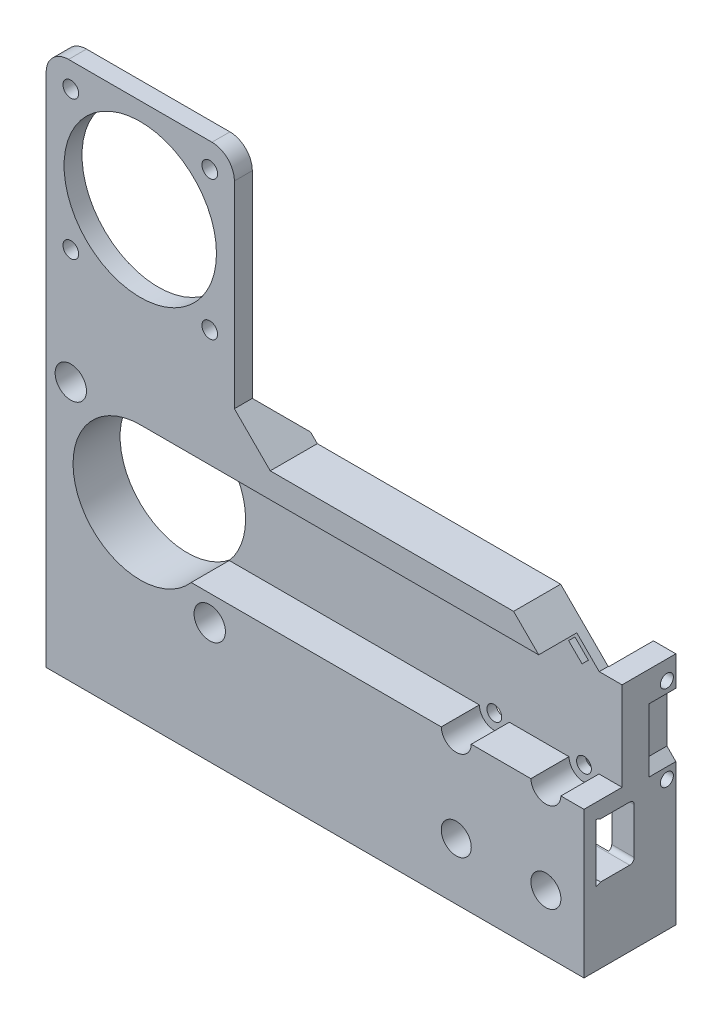
from build123d import *

# Parameters (mm, degrees)
SKETCH1_W               = 120
SKETCH1_H               = 45.4
BOSS_EXTRUDE1_DEPTH     = 10.5
SKETCH2_W               = 5
SKETCH2_H               = 45.4
BOSS_EXTRUDE2_DEPTH     = 10
CUT_EXTRUDE1_DEPTH      = 7.8
CUT_EXTRUDE1_DEPTH_BACK = 129.729988736
SKETCH3_W               = 78
SKETCH3_H               = 12.2
BOSS_EXTRUDE3_START     = -10.5
SKETCH4_W               = 42
SKETCH4_H               = 41
BOSS_EXTRUDE3_DEPTH     = 10.5
SKETCH5_R               = 15
SKETCH5_R_2             = 1.7
CUT_EXTRUDE2_DEPTH      = 138.073885186
SKETCH7_W               = 30
SKETCH7_H               = 8
BOSS_EXTRUDE4_DEPTH     = 44.2
SKETCH8_R               = 1.65
CUT_EXTRUDE4_DEPTH      = 147.154336234
FILLET1_SIZE            = 15
FILLET1_SIZE_2          = 6
SKETCH9_R               = 2.6
SKETCH9_R_2             = 12
CUT_EXTRUDE5_DEPTH      = 10
SKETCH10_R              = 3.35
CUT_EXTRUDE6_DEPTH      = 8.5
SKETCH12_R              = 3.5
CUT_EXTRUDE7_DEPTH      = 5.5
SKETCH6_W               = 105.644224039
SKETCH6_H               = 30.4
CUT_EXTRUDE3_DEPTH      = 8.5
CHAMFER1_SIZE           = 5
CHAMFER1_SIZE2          = 13.737387097
SKETCH13_W              = 14
SKETCH13_H              = 32.158687744
CUT_EXTRUDE8_DEPTH      = 10
CUT_EXTRUDE16_DEPTH     = 78
SKETCH24_W              = 5
SKETCH24_H              = 9.3
BOSS_EXTRUDE8_DEPTH     = 12.2
FILLET4_START           = 115
FILLET4_DEPTH           = 5
FILLET4_START_2         = 41
FILLET4_2_DEPTH         = 79
SKETCH15_R              = 2.75
BOSS_EXTRUDE9_DEPTH     = 2
CHAMFER4_SIZE           = 2
CHAMFER5_DEPTH          = 8
SKETCH25_W              = 5
SKETCH25_H              = 12
BOSS_EXTRUDE10_DEPTH    = 7
SKETCH26_R              = 1.45
CUT_EXTRUDE17_DEPTH     = 7
SKETCH27_W              = 2
SKETCH27_H              = 14.15
CUT_EXTRUDE18_DEPTH     = 6
CHAMFER6_SIZE           = 2
SKETCH28_W              = 2
SKETCH28_H              = 17.6
BOSS_EXTRUDE11_DEPTH    = 73
SKETCH30_W              = 94
SKETCH30_H              = 5.6
BOSS_EXTRUDE12_DEPTH    = 8.5
CHAMFER8_SIZE           = 10.7
SKETCH31_W              = 42
SKETCH31_H              = 4
BOSS_EXTRUDE13_DEPTH    = 57
SKETCH32_R              = 17.001029839
CUT_EXTRUDE20_DEPTH     = 10
SKETCH33_R              = 1.75
CUT_EXTRUDE21_DEPTH     = 10
CHAMFER10_SIZE          = 8
FILLET6_R               = 5
CHAMFER11_SIZE          = 8
CUT_EXTRUDE22_DEPTH     = 10


with BuildPart() as part:
    # Sketch1 → Boss-Extrude1 (new body)
    with BuildSketch(Plane.XY):
        with Locations((60, 22.7)):
            Rectangle(SKETCH1_W, SKETCH1_H)
    extrude(amount=BOSS_EXTRUDE1_DEPTH)

    # Sketch2 → Boss-Extrude2 (add)
    with BuildSketch(Plane(origin=(0, 0, 0), x_dir=(-1, 0, 0), z_dir=(0, 0, -1))):
        with Locations((-117.5, 22.7)):
            Rectangle(SKETCH2_W, SKETCH2_H)
    extrude(amount=BOSS_EXTRUDE2_DEPTH)

    # Sketch3 → Cut-Extrude1 (cut, two sides: drawn at the far end of the back side and taken through both)
    with BuildSketch(Plane.XY.offset(-CUT_EXTRUDE1_DEPTH_BACK)):
        with Locations((81, 22.8)):
            Rectangle(SKETCH3_W, SKETCH3_H)
    extrude(amount=CUT_EXTRUDE1_DEPTH + CUT_EXTRUDE1_DEPTH_BACK, mode=Mode.SUBTRACT)

    # Sketch4 → Boss-Extrude3 (add)
    with BuildSketch(Plane(origin=(0, 0, 0), x_dir=(-1, 0, 0), z_dir=(0, 0, -1)).offset(BOSS_EXTRUDE3_START)):
        with Locations((-21, 42.5)):
            Rectangle(SKETCH4_W, SKETCH4_H)
    extrude(amount=BOSS_EXTRUDE3_DEPTH)

    # Sketch5 → Cut-Extrude2 (cut, through all)
    with BuildSketch(Plane.XY.offset(10.5)):
        with Locations((21, 42.4)):
            Circle(SKETCH5_R)
        with Locations((5.5, 57.9)):
            Circle(SKETCH5_R_2)
        with Locations((36.5, 26.9)):
            Circle(SKETCH5_R_2)
    extrude(amount=-CUT_EXTRUDE2_DEPTH, mode=Mode.SUBTRACT)

    # Sketch7 → Boss-Extrude4 (add)
    with BuildSketch(Plane(origin=(0, 0, 0), x_dir=(-1, 0, 0), z_dir=(0, 0, -1))):
        with Locations((-65.5, 4)):
            Rectangle(SKETCH7_W, SKETCH7_H)
    extrude(amount=BOSS_EXTRUDE4_DEPTH)

    # Sketch8 → Cut-Extrude4 (cut, through all)
    with BuildSketch(Plane.XY.offset(10.5)):
        with Locations((91.5, 32.7)):
            Circle(SKETCH8_R)
        with Locations((111.5, 32.7)):
            Circle(SKETCH8_R)
        with Locations((111.5, 12.7)):
            Circle(SKETCH8_R)
        with Locations((91.5, 12.7)):
            Circle(SKETCH8_R)
    extrude(amount=-CUT_EXTRUDE4_DEPTH, mode=Mode.SUBTRACT)

    # Fillet1
    # a fillet whose section is not a circle: 15, 6 mm, written as the material it takes off along each edge
    with BuildSketch(Plane(origin=(50.5, -37.5, -44.2), x_dir=(1, 0, 0), z_dir=(0, 1, 0))) as fillet1_piece_1:
        with BuildLine():
            Bezier((FILLET1_SIZE, 0), (0, 0), (0, -FILLET1_SIZE_2), weights=[1, 0.428571429, 1])
            Line((0, -FILLET1_SIZE_2), (0, 0))
            Line((0, 0), (FILLET1_SIZE, 0))
        make_face()
    extrude(amount=83, mode=Mode.SUBTRACT)
    with BuildSketch(Plane(origin=(80.5, 45.5, -44.2), x_dir=(0, 0, 1), z_dir=(0, -1, 0))) as fillet1_piece_2:
        with BuildLine():
            Bezier((FILLET1_SIZE_2, 0), (0, 0), (0, FILLET1_SIZE), weights=[1, 0.428571429, 1])
            Line((0, FILLET1_SIZE), (0, 0))
            Line((0, 0), (FILLET1_SIZE_2, 0))
        make_face()
    extrude(amount=83, mode=Mode.SUBTRACT)

    # Sketch9 → Cut-Extrude5 (cut)
    with BuildSketch(Plane(origin=(0, 8, 0), x_dir=(1, 0, 0), z_dir=(0, 1, 0))):
        with Locations(Location((54.155391929, 34.515048602, 0), (0, 0, 180))):
            Circle(SKETCH9_R)
        with Locations(Location((65.469100428, 39.201340103, 0), (0, 0, 180))):
            Circle(SKETCH9_R)
        with Locations(Location((76.782808927, 34.515048602, 0), (0, 0, 180))):
            Circle(SKETCH9_R)
        with Locations(Location((65.469100428, 23.201340103, 0), (0, 0, 180))):
            Circle(SKETCH9_R_2)
        with Locations(Location((54.155391929, 11.887631605, 0), (0, 0, 180))):
            Circle(SKETCH9_R)
        with Locations(Location((76.782808927, 11.887631605, 0), (0, 0, 180))):
            Circle(SKETCH9_R)
    extrude(amount=-CUT_EXTRUDE5_DEPTH, mode=Mode.SUBTRACT)

    # Sketch10 → Cut-Extrude6 (cut)
    with BuildSketch(Plane.XY.offset(10.5)):
        with Locations((91.5, 32.7)):
            Circle(SKETCH10_R)
        with Locations((111.5, 32.7)):
            Circle(SKETCH10_R)
        with Locations((111.5, 12.7)):
            Circle(SKETCH10_R)
        with Locations((91.5, 12.7)):
            Circle(SKETCH10_R)
    extrude(amount=-CUT_EXTRUDE6_DEPTH, mode=Mode.SUBTRACT)

    # Sketch12 → Cut-Extrude7 (cut)
    with BuildSketch(Plane.XY.offset(10.5)):
        with Locations((5.5, 57.9)):
            Circle(SKETCH12_R)
        with Locations((36.5, 26.9)):
            Circle(SKETCH12_R)
    extrude(amount=-CUT_EXTRUDE7_DEPTH, mode=Mode.SUBTRACT)

    # Sketch6 → Cut-Extrude3 (cut)
    with BuildSketch(Plane.XY.offset(10.5)):
        with Locations((73.822112019, 47.8)):
            Rectangle(SKETCH6_W, SKETCH6_H)
    extrude(amount=-CUT_EXTRUDE3_DEPTH, mode=Mode.SUBTRACT)

    # Chamfer1
    chamfer1_edges = [part.edges().sort_by_distance(p)[0] for p in [
        (80.5, 4, 0),
    ]]
    chamfer1_side = [part.faces().sort_by_distance(p)[0] for p in [
        (40.688741063, 22.8, 0),
    ]]
    chamfer(chamfer1_edges, length=CHAMFER1_SIZE, length2=CHAMFER1_SIZE2, reference=chamfer1_side[0])

    # Sketch13 → Cut-Extrude8 (cut)
    with BuildSketch(Plane(origin=(0, 8, 0), x_dir=(1, 0, 0), z_dir=(0, 1, 0))):
        with Locations((65.469100428, 39.201340103)):
            Rectangle(SKETCH13_W, SKETCH13_H)
    extrude(amount=-CUT_EXTRUDE8_DEPTH, mode=Mode.SUBTRACT)

    # Sketch23 → Cut-Extrude16 (cut)
    with BuildSketch(Plane(origin=(120, 0, 0), x_dir=(0, 0, -1), z_dir=(1, 0, 0))):
        Polygon((-6.8, 28.9), (-7.8, 28.9), (-7.8, 29.3), align=None)
        Polygon((-7.8, 16.7), (-7.8, 16.3), (-6.8, 16.7), align=None)
    extrude(amount=-CUT_EXTRUDE16_DEPTH, mode=Mode.SUBTRACT)

    # Sketch24 → Boss-Extrude8 (add)
    with BuildSketch(Plane(origin=(0, 16.7, 0), x_dir=(1, 0, 0), z_dir=(0, 1, 0))):
        with Locations((117.5, 5.35)):
            Rectangle(SKETCH24_W, SKETCH24_H)
    extrude(amount=BOSS_EXTRUDE8_DEPTH)

    # Fillet4: read off the stored shape, not the designer's step
    # Fillet4 outline → Fillet4 (add)
    with BuildSketch(Plane.YZ.offset(FILLET4_START)):
        with BuildLine():
            ThreePointArc((28.9, 0.3), (28.607106781, -0.407106781), (27.9, -0.7))
            Line((27.9, -0.7), (28.9, -0.7))
            Line((28.9, -0.7), (28.9, 0.3))
        make_face()
        with BuildLine():
            Line((16.7, 0.3), (16.7, -0.7))
            Line((16.7, -0.7), (17.7, -0.7))
            ThreePointArc((17.7, -0.7), (16.992893219, -0.407106781), (16.7, 0.3))
        make_face()
    extrude(amount=FILLET4_DEPTH)

    # Fillet4 2 outline → Fillet4 2 (add)
    with BuildSketch(Plane.YZ.offset(FILLET4_START_2)):
        with BuildLine():
            Line((28.9, 0), (28.9, 0.3))
            ThreePointArc((28.9, 0.3), (28.888417726, 0.148242301), (28.853939201, 0))
            Line((28.853939201, 0), (28.9, 0))
        make_face()
        with BuildLine():
            Line((16.7, 0), (16.746060799, 0))
            ThreePointArc((16.746060799, 0), (16.711582274, 0.148242301), (16.7, 0.3))
            Line((16.7, 0.3), (16.7, 0))
        make_face()
    extrude(amount=FILLET4_2_DEPTH)

    # Sketch15 → Boss-Extrude9 (add)
    with BuildSketch(Plane(origin=(0, 8, 0), x_dir=(1, 0, 0), z_dir=(0, 1, 0))):
        with Locations((65.469100428, 7.201340104)):
            Circle(SKETCH15_R)
    extrude(amount=BOSS_EXTRUDE9_DEPTH)

    # Chamfer4
    chamfer4_edges = [part.edges().sort_by_distance(p)[0] for p in [
        (62.719100428, 10, -7.201340104),
    ]]
    chamfer(chamfer4_edges, length=CHAMFER4_SIZE - 0.0001)  # a hair under: the kernel refuses the full size

    # Chamfer5: read off the stored shape, not the designer's step
    # Chamfer5 outline → Chamfer5 (add)
    with BuildSketch(Plane(origin=(0, 0, 0), x_dir=(1, 0, 0), z_dir=(0, 1, 0))):
        with BuildLine():
            add(Edge.make_bspline(
                [(50.775443099, 38.961367817), (50.5, 38.551094872), (50.5, 38.2)],
                knots=[0.873344875, 0.873344875, 0.873344875, 1, 1, 1], degree=2, weights=[0.873584452, 0.927625643, 1]))
            Line((50.775443099, 38.961367817), (0, 0))
            Line((0, 0), (50.5, 0))
            Line((50.5, 0), (50.5, 38.2))
        make_face()
    extrude(amount=CHAMFER5_DEPTH)

    # Sketch25 → Boss-Extrude10 (add)
    with BuildSketch(Plane(origin=(0, 45.4, 0), x_dir=(1, 0, 0), z_dir=(0, 1, 0))):
        with Locations((117.5, 4)):
            Rectangle(SKETCH25_W, SKETCH25_H)
    extrude(amount=BOSS_EXTRUDE10_DEPTH)

    # Sketch26 → Cut-Extrude17 (cut)
    with BuildSketch(Plane(origin=(120, 0, 0), x_dir=(0, 0, -1), z_dir=(1, 0, 0))):
        with Locations(Location((8, 48.175, 0), (0, 0, 90))):
            Circle(SKETCH26_R)
        with Locations(Location((8, 29.125, 0), (0, 0, 90))):
            Circle(SKETCH26_R)
    extrude(amount=-CUT_EXTRUDE17_DEPTH, mode=Mode.SUBTRACT)

    # Sketch27 → Cut-Extrude18 (cut)
    with BuildSketch(Plane(origin=(0, 0, -10), x_dir=(-1, 0, 0), z_dir=(0, 0, -1))):
        with Locations((-119, 38.65)):
            Rectangle(SKETCH27_W, SKETCH27_H)
    extrude(amount=-CUT_EXTRUDE18_DEPTH, mode=Mode.SUBTRACT)

    # Chamfer6
    chamfer6_edges = [part.edges().sort_by_distance(p)[0] for p in [
        (118, 45.725, -7),
        (118, 31.575, -7),
    ]]
    chamfer(chamfer6_edges, length=CHAMFER6_SIZE - 0.0001)  # a hair under: the kernel refuses the full size

    # Sketch28 → Boss-Extrude11 (add)
    with BuildSketch(Plane(origin=(42, 0, 0), x_dir=(0, 0, -1), z_dir=(1, 0, 0))):
        with Locations((-1, 54.2)):
            Rectangle(SKETCH28_W, SKETCH28_H)
    extrude(amount=BOSS_EXTRUDE11_DEPTH)

    # Sketch30 → Boss-Extrude12 (add)
    with BuildSketch(Plane.XY.offset(2)):
        with Locations((68, 60.2)):
            Rectangle(SKETCH30_W, SKETCH30_H)
    extrude(amount=BOSS_EXTRUDE12_DEPTH)

    # Chamfer8
    # the kernel refuses this chamfer: 10.7 mm, written as the material it takes off along each edge
    with BuildSketch(Plane(origin=(115, 63, -27.517007971), x_dir=(-1, 0, 0), z_dir=(0, 0, 1))) as chamfer8_piece_1_section:
        Polygon((CHAMFER8_SIZE, 0), (0, CHAMFER8_SIZE), (0, 0), align=None)
    chamfer8_piece_1 = extrude(amount=65.534015942, mode=Mode.PRIVATE)
    chamfer8_piece_1 = split(chamfer8_piece_1, bisect_by=Plane(origin=(115, 52.4, -27.517007971), z_dir=(0, 1, 0)), keep=Keep.TOP, mode=Mode.PRIVATE)
    add(chamfer8_piece_1, mode=Mode.SUBTRACT)

    # Sketch31 → Boss-Extrude13 (add)
    with BuildSketch(Plane(origin=(0, 63, 0), x_dir=(1, 0, 0), z_dir=(0, 1, 0))):
        with Locations((21, -8.5)):
            Rectangle(SKETCH31_W, SKETCH31_H)
    extrude(amount=BOSS_EXTRUDE13_DEPTH)

    # Sketch32 → Cut-Extrude20 (cut)
    with BuildSketch(Plane.XY.offset(10.5)):
        with Locations((21.000438713, 99)):
            Circle(SKETCH32_R)
    extrude(amount=-CUT_EXTRUDE20_DEPTH, mode=Mode.SUBTRACT)

    # Sketch33 → Cut-Extrude21 (cut)
    with BuildSketch(Plane(origin=(0, 0, 6.5), x_dir=(-1, 0, 0), z_dir=(0, 0, -1))):
        with Locations((-36.500438713, 114.5)):
            Circle(SKETCH33_R)
        with Locations((-5.500438713, 114.5)):
            Circle(SKETCH33_R)
        with Locations((-5.500438713, 83.5)):
            Circle(SKETCH33_R)
        with Locations((-36.500438713, 83.5)):
            Circle(SKETCH33_R)
    extrude(amount=-CUT_EXTRUDE21_DEPTH, mode=Mode.SUBTRACT)

    # Chamfer10
    chamfer10_edges = [part.edges().sort_by_distance(p)[0] for p in [
        (42, 63, 8.5),
    ]]
    chamfer(chamfer10_edges, length=CHAMFER10_SIZE)

    # Fillet6
    fillet6_edges = [part.edges().sort_by_distance(p)[0] for p in [
        (0, 120, 8.5),
        (42, 120, 8.5),
    ]]
    fillet(fillet6_edges, radius=FILLET6_R)

    # Chamfer11
    # the kernel refuses this chamfer: 8 mm, written as the material it adds along each edge
    with BuildSketch(Plane(origin=(0, 63, 6.5), x_dir=(0, 0, -1), z_dir=(1, 0, 0))) as chamfer11_piece_1_section:
        Polygon((CHAMFER11_SIZE, 0), (0, CHAMFER11_SIZE), (0, 0), align=None)
    chamfer11_piece_1 = extrude(amount=70.573463904, mode=Mode.PRIVATE)
    chamfer11_piece_1 = split(chamfer11_piece_1, bisect_by=Plane(origin=(42, 63, 6.5), z_dir=(-1, 0, 0)), keep=Keep.TOP, mode=Mode.PRIVATE)
    chamfer11_piece_1 = split(chamfer11_piece_1, bisect_by=Plane(origin=(0, 63, 0), z_dir=(0, 0, 1)), keep=Keep.TOP, mode=Mode.PRIVATE)
    add(chamfer11_piece_1)
    with BuildSketch(Plane(origin=(0, 63, 6.5), x_dir=(0, 0, -1), z_dir=(1, 0, 0))) as chamfer11_piece_2_section:
        Polygon((CHAMFER11_SIZE, 0), (0, CHAMFER11_SIZE), (0, 0), align=None)
    chamfer11_piece_2 = extrude(amount=70.573463904, mode=Mode.PRIVATE)
    chamfer11_piece_2 = split(chamfer11_piece_2, bisect_by=Plane(origin=(42, 63, 6.5), z_dir=(1, 0, 0)), keep=Keep.TOP, mode=Mode.PRIVATE)
    chamfer11_piece_2 = split(chamfer11_piece_2, bisect_by=Plane(origin=(25, 88, 6.5), z_dir=(-0.7071067811865476, -0.7071067811865476, 0)), keep=Keep.TOP, mode=Mode.PRIVATE)
    chamfer11_piece_2 = split(chamfer11_piece_2, bisect_by=Plane(origin=(0, 63, 0), z_dir=(0, 0, 1)), keep=Keep.TOP, mode=Mode.PRIVATE)
    add(chamfer11_piece_2)

    # Sketch34 → Cut-Extrude22 (cut)
    with BuildSketch(Plane.XY.offset(2)):
        Polygon((109.485786438, 56.4), (108.071572875, 54.985786438), (111.071572875, 51.985786438), (112.485786438, 53.4), align=None)
    extrude(amount=-CUT_EXTRUDE22_DEPTH, mode=Mode.SUBTRACT)


solid = part.part
